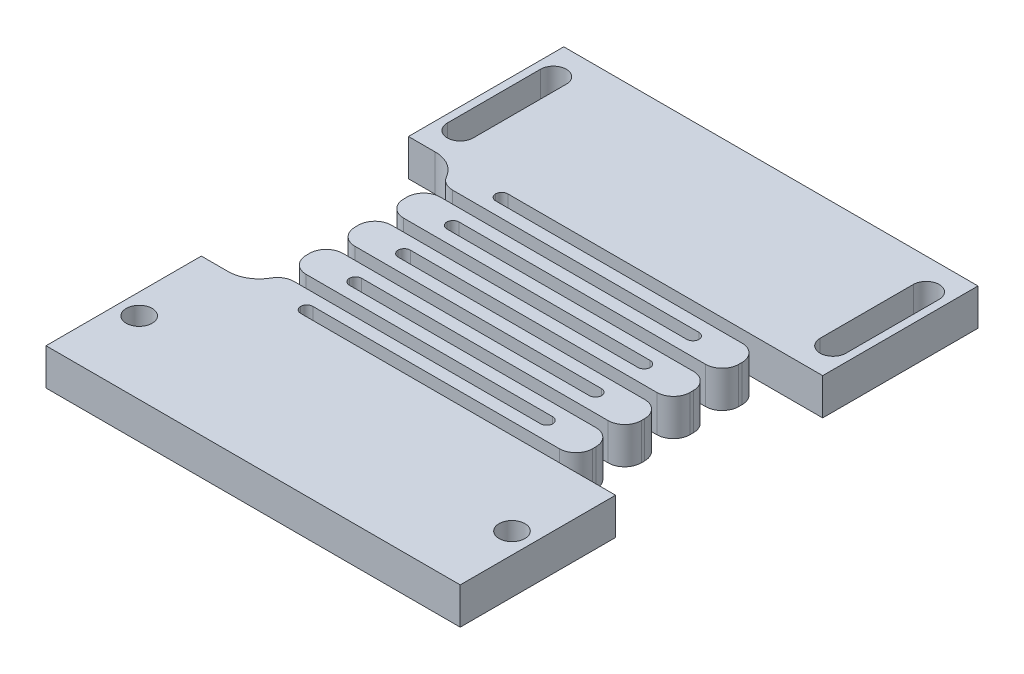
from build123d import *

# Parameters (mm, degrees)
BOSS_EXTRUDE1_DEPTH     = 4.4958
CUT_EXTRUDE1_DEPTH      = 82.4438593
CUT_EXTRUDE1_DEPTH_BACK = 82.4438593
SKETCH3_R               = 1.5875
CUT_EXTRUDE2_DEPTH      = 82.4438593
CUT_EXTRUDE2_DEPTH_BACK = 82.4438593
SKETCH4_W               = 33.02
SKETCH4_H               = 1.494117647
SKETCH4_H_2             = 1.494117648
FILLET1_R               = 0.762
FILLET2_R               = 2.032
FILLET3_R               = 3.81
FILLET4_R               = 3.81


with BuildPart() as part:
    # Sketch1 → Boss-Extrude1 (new body)
    with BuildSketch(Plane(origin=(0, 0, 0), x_dir=(1, 0, 0), z_dir=(0, 1, 0))):
        Polygon((-50.8, 63.5), (0, 63.5), (0, 44.45), (-6.35, 44.45), (-6.35, 19.05), (0, 19.05), (0, 0), (-50.8, 0), (-50.8, 19.05), (-44.45, 19.05), (-44.45, 44.45), (-50.8, 44.45), align=None)
    extrude(amount=BOSS_EXTRUDE1_DEPTH)

    # Sketch3 → Cut-Extrude1 (cut, two sides: drawn at the far end of the back side and taken through both)
    with BuildSketch(Plane(origin=(0, 4.4958, 0), x_dir=(1, 0, 0), z_dir=(0, 1, 0)).offset(-CUT_EXTRUDE1_DEPTH_BACK)):
        with Locations(Location((-48.26, 8.89, 0), (0, 0, 270))):
            Circle(SKETCH3_R)
        with Locations(Location((-2.54, 8.89, 0), (0, 0, 270))):
            Circle(SKETCH3_R)
        with BuildLine():
            Line((-49.8475, 48.26), (-49.8475, 59.69))
            ThreePointArc((-49.8475, 59.69), (-48.26, 61.2775), (-46.6725, 59.69))
            Line((-46.6725, 59.69), (-46.6725, 48.26))
            ThreePointArc((-46.6725, 48.26), (-48.26, 46.6725), (-49.8475, 48.26))
        make_face()
        with BuildLine():
            Line((-4.1275, 48.26), (-4.1275, 59.69))
            ThreePointArc((-4.1275, 59.69), (-2.54, 61.2775), (-0.9525, 59.69))
            Line((-0.9525, 59.69), (-0.9525, 48.26))
            ThreePointArc((-0.9525, 48.26), (-2.54, 46.6725), (-4.1275, 48.26))
        make_face()
    extrude(amount=CUT_EXTRUDE1_DEPTH + CUT_EXTRUDE1_DEPTH_BACK, mode=Mode.SUBTRACT)

    # Sketch4 → Cut-Extrude2 (cut, two sides: drawn at the far end of the back side and taken through both)
    with BuildSketch(Plane(origin=(0, 4.4958, 0), x_dir=(1, 0, 0), z_dir=(0, 1, 0)).offset(-CUT_EXTRUDE2_DEPTH_BACK)):
        with Locations((-27.94, 34.738235295)):
            Rectangle(SKETCH4_W, SKETCH4_H)
        with Locations((-22.86, 19.797058824)):
            Rectangle(SKETCH4_W, SKETCH4_H)
        with Locations((-27.94, 22.785294118)):
            Rectangle(SKETCH4_W, SKETCH4_H)
        with Locations((-22.86, 25.773529412)):
            Rectangle(SKETCH4_W, SKETCH4_H)
        with Locations((-27.94, 28.761764705)):
            Rectangle(SKETCH4_W, SKETCH4_H)
        with Locations((-22.86, 31.75)):
            Rectangle(SKETCH4_W, SKETCH4_H_2)
        with Locations((-22.86, 37.726470589)):
            Rectangle(SKETCH4_W, SKETCH4_H)
        with Locations((-27.94, 40.714705882)):
            Rectangle(SKETCH4_W, SKETCH4_H)
        with Locations((-22.86, 43.702941177)):
            Rectangle(SKETCH4_W, SKETCH4_H)
    extrude(amount=CUT_EXTRUDE2_DEPTH + CUT_EXTRUDE2_DEPTH_BACK, mode=Mode.SUBTRACT)

    # Fillet1
    # the kernel refuses this fillet: 0.762 mm, written as the material it adds along each edge
    with BuildSketch(Plane(origin=(-39.37, 0, -32.497058824), x_dir=(0, 0, 1), z_dir=(0, 1, 0)), Plane(origin=(-11.43, 0, -29.508823529), x_dir=(-1, 0, 0), z_dir=(0, 1, 0)), Plane(origin=(-11.43, 0, -28.014705882), x_dir=(0, 0, -1), z_dir=(0, 1, 0)), Plane(origin=(-39.37, 0, -31.002941176), x_dir=(1, 0, 0), z_dir=(0, 1, 0)), Plane(origin=(-39.37, 0, -20.544117647), x_dir=(0, 0, 1), z_dir=(0, 1, 0)), Plane(origin=(-39.37, 0, -36.979411765), x_dir=(1, 0, 0), z_dir=(0, 1, 0)), Plane(origin=(-39.37, 0, -42.955882353), x_dir=(1, 0, 0), z_dir=(0, 1, 0)), Plane(origin=(-39.37, 0, -38.473529412), x_dir=(0, 0, 1), z_dir=(0, 1, 0)), Plane(origin=(-39.37, 0, -44.45), x_dir=(0, 0, 1), z_dir=(0, 1, 0)), Plane(origin=(-11.43, 0, -33.991176471), x_dir=(0, 0, -1), z_dir=(0, 1, 0)), Plane(origin=(-11.43, 0, -39.967647059), x_dir=(0, 0, -1), z_dir=(0, 1, 0)), Plane(origin=(-11.43, 0, -35.485294118), x_dir=(-1, 0, 0), z_dir=(0, 1, 0)), Plane(origin=(-11.43, 0, -41.461764706), x_dir=(-1, 0, 0), z_dir=(0, 1, 0))) as fillet1_piece_1:
        with BuildLine():
            CenterArc((FILLET1_R, FILLET1_R), FILLET1_R, 180, 90)
            Line((0, FILLET1_R), (0, 0))
            Line((0, 0), (FILLET1_R, 0))
        make_face()
    extrude(amount=4.4958)
    with BuildSketch(Plane(origin=(-11.43, 4.4958, -22.038235294), x_dir=(0, 0, -1), z_dir=(0, -1, 0)), Plane(origin=(-11.43, 4.4958, -23.532352941), x_dir=(-1, 0, 0), z_dir=(0, -1, 0)), Plane(origin=(-39.37, 4.4958, -25.026470588), x_dir=(1, 0, 0), z_dir=(0, -1, 0)), Plane(origin=(-39.37, 4.4958, -26.520588235), x_dir=(0, 0, 1), z_dir=(0, -1, 0)), Plane(origin=(-39.37, 4.4958, -19.05), x_dir=(1, 0, 0), z_dir=(0, -1, 0))) as fillet1_piece_2:
        with BuildLine():
            CenterArc((FILLET1_R, -FILLET1_R), FILLET1_R, 90, 90)
            Line((0, -FILLET1_R), (0, 0))
            Line((0, 0), (FILLET1_R, 0))
        make_face()
    extrude(amount=4.4958)

    # Fillet2
    fillet2_edges = [part.edges().sort_by_distance(p)[0] for p in [
        (-6.35, 2.2479, -26.520588235),
        (-6.35, 2.2479, -25.026470588),
        (-44.45, 2.2479, -22.038235294),
        (-44.45, 2.2479, -23.532352941),
        (-44.45, 2.2479, -28.014705882),
        (-44.45, 2.2479, -29.508823529),
        (-6.35, 2.2479, -32.497058824),
        (-6.35, 2.2479, -31.002941176),
        (-44.45, 2.2479, -33.991176471),
        (-44.45, 2.2479, -35.485294118),
        (-6.35, 2.2479, -38.473529412),
        (-6.35, 2.2479, -36.979411765),
        (-44.45, 2.2479, -39.967647059),
        (-44.45, 2.2479, -41.461764706),
        (-6.35, 2.2479, -42.955882353),
        (-6.35, 2.2479, -20.544117647),
    ]]
    fillet(fillet2_edges, radius=FILLET2_R)

    # Fillet3
    # the kernel refuses this fillet: 3.81 mm, written as the material it adds along each edge
    with BuildSketch(Plane(origin=(-44.45, 0, -44.45), x_dir=(-1, 0, 0), z_dir=(0, 1, 0))) as fillet3_piece_1:
        with BuildLine():
            CenterArc((3.065547548, 3.81), FILLET3_R, 209.241450743, 60.758549257)
            Line((-0.258939983, 1.948849105), (-0.591388736, 1.762734015))
            ThreePointArc((-0.591388736, 1.762734015), (-0.381, 0.956235294), (-0.381, 0))
            Line((-0.381, 0), (0, -0.381))
            Line((0, -0.381), (3.065547548, -0.381))
            Line((3.065547548, -0.381), (3.065547548, 0))
        make_face()
    extrude(amount=4.4958)

    # Fillet4
    # the kernel refuses this fillet: 3.81 mm, written as the material it adds along each edge
    with BuildSketch(Plane(origin=(-44.45, 0, -19.05), x_dir=(0.1317106342839345, 0, -0.9912882067373362), z_dir=(0, 1, 0))) as fillet4_piece_1:
        with BuildLine():
            CenterArc((3.373042856, 3.540658648), FILLET4_R, 187.568454523, 60.758549257)
            Line((-0.403765212, 3.038841131), (-0.781446019, 2.98865938))
            Line((-0.781446019, 2.98865938), (-0.377680807, -0.050181752))
            Line((-0.377680807, -0.050181752), (0.050181752, -0.377680807))
            ThreePointArc((0.050181752, -0.377680807), (0.998086522, -0.25173445), (1.825269627, -0.354065865))
            Line((1.825269627, -0.354065865), (1.965976284, 0))
        make_face()
    extrude(amount=4.4958)


solid = part.part
